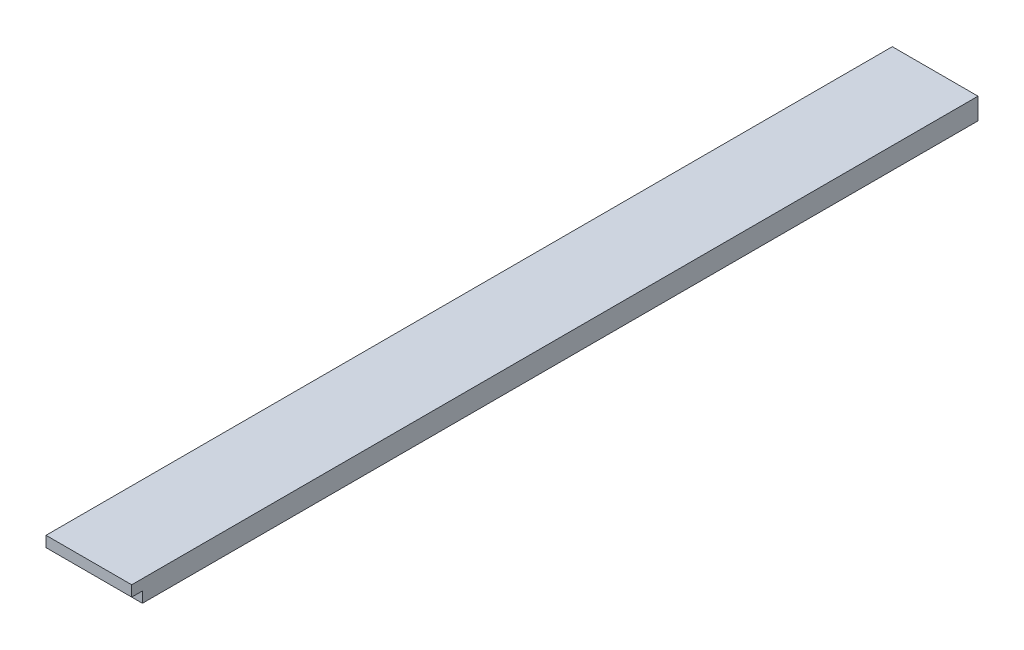
from build123d import *

# Parameters (mm, degrees)
BOSS_EXTRUDE1_DEPTH = 501.65
SKETCH2_W           = 38.1
SKETCH2_H           = 6.35
CUT_EXTRUDE1_DEPTH  = 6.35


with BuildPart() as part:
    # Sketch1 → Boss-Extrude1 (new body)
    with BuildSketch(Plane.XY):
        Polygon((0, 12.7), (0, 6.35), (12.7, 6.35), (12.7, 0), (50.8, 0), (50.8, 12.7), align=None)
    extrude(amount=BOSS_EXTRUDE1_DEPTH)

    # Sketch2 → Cut-Extrude1 (cut)
    with BuildSketch(Plane.XZ):
        with Locations((31.75, 498.475)):
            Rectangle(SKETCH2_W, SKETCH2_H)
    extrude(amount=-CUT_EXTRUDE1_DEPTH, mode=Mode.SUBTRACT)


solid = part.part
